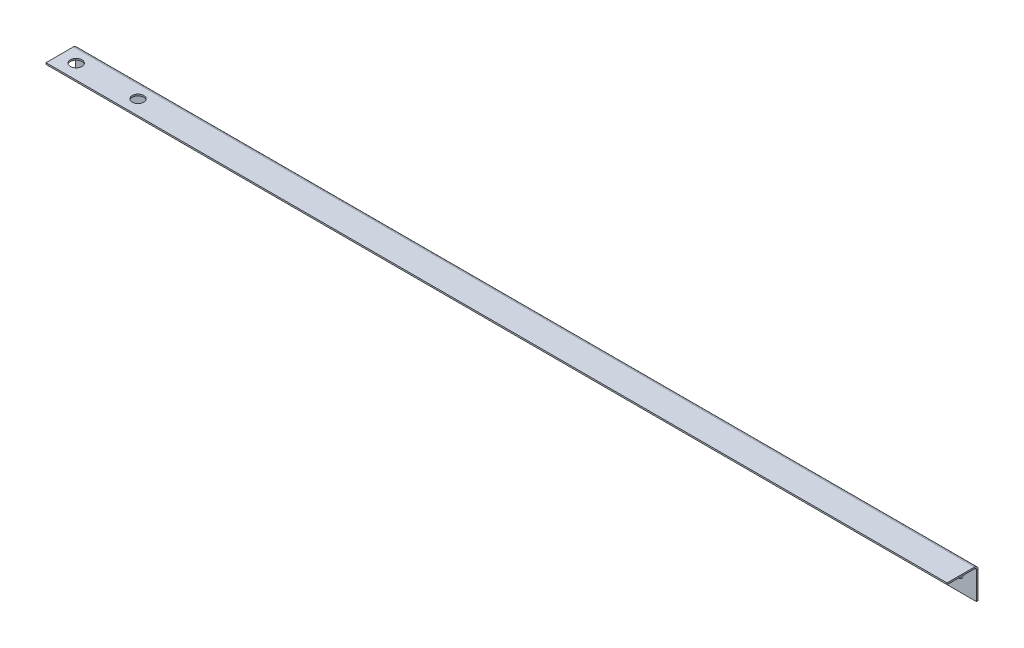
from build123d import *

# Parameters (mm, degrees)
SKETCH1_W                    = 1165
SKETCH1_H                    = 40
BASE_FLANGE1_DEPTH           = 2
EDGE_FLANGE1_STRIP_W         = 13
EDGE_FLANGE1_STRIP_H         = 2
EDGE_FLANGE1_STRIP_CUT_DEPTH = 1165
EDGE_FLANGE1_DEPTH           = 1165
SKETCH9_R                    = 7.5
CUT_EXTRUDE1_DEPTH           = 671.102657441


# Sheet-metal steps are written as plain solids
with BuildPart() as part:
    # Sketch1 → Base-Flange1 (new body)
    with BuildSketch(Plane.XY):
        with Locations((-85.444287729, 62.85774027)):
            Rectangle(SKETCH1_W, SKETCH1_H)
        with BuildLine():
            Line((474.555712271, 57.85774027), (459.555712271, 57.85774027))
            ThreePointArc((459.555712271, 57.85774027), (454.555712271, 62.85774027), (459.555712271, 67.85774027))
            Line((459.555712271, 67.85774027), (474.555712271, 67.85774027))
            ThreePointArc((474.555712271, 67.85774027), (479.555712271, 62.85774027), (474.555712271, 57.85774027))
        make_face(mode=Mode.SUBTRACT)
        with BuildLine():
            Line((374.555712271, 57.85774027), (359.555712271, 57.85774027))
            ThreePointArc((359.555712271, 57.85774027), (354.555712271, 62.85774027), (359.555712271, 67.85774027))
            Line((359.555712271, 67.85774027), (374.555712271, 67.85774027))
            ThreePointArc((374.555712271, 67.85774027), (379.555712271, 62.85774027), (374.555712271, 57.85774027))
        make_face(mode=Mode.SUBTRACT)
    extrude(amount=-BASE_FLANGE1_DEPTH)

    # Edge-Flange1 strip (across the edge) → Edge-Flange1 strip cut (cut)
    with BuildSketch(Plane(origin=(497.055712271, 82.85774027, 0), x_dir=(0, -1, 0), z_dir=(-1, 0, 0))):
        with Locations((-2, -1)):
            Rectangle(EDGE_FLANGE1_STRIP_W, EDGE_FLANGE1_STRIP_H)
    extrude(amount=EDGE_FLANGE1_STRIP_CUT_DEPTH, mode=Mode.SUBTRACT)

    # Edge-Flange1 section (across the edge) → Edge-Flange1 (add)
    with BuildSketch(Plane(origin=(497.055712271, 82.85774027, 0), x_dir=(0, -1, 0), z_dir=(-1, 0, 0))):
        with BuildLine():
            Line((0, 2.5), (0, 38))
            Line((0, 38), (2, 38))
            Line((2, 38), (2, 2.5))
            ThreePointArc((2, 2.5), (2.732233047, 0.732233047), (4.5, 0))
            Line((4.5, 0), (4.5, -2))
            ThreePointArc((4.5, -2), (1.318019485, -0.681980515), (0, 2.5))
        make_face()
    extrude(amount=EDGE_FLANGE1_DEPTH)

    # Sketch9 → Cut-Extrude1 (cut, through all)
    with BuildSketch(Plane.XZ.offset(-80.85774027)):
        with Locations(Location((-647.944287729, 19, 0), (0, 0, 270))):
            Circle(SKETCH9_R)
        with Locations(Location((-567.944287729, 19, 0), (0, 0, 270))):
            Circle(SKETCH9_R)
    extrude(amount=-CUT_EXTRUDE1_DEPTH, mode=Mode.SUBTRACT)


solid = part.part
